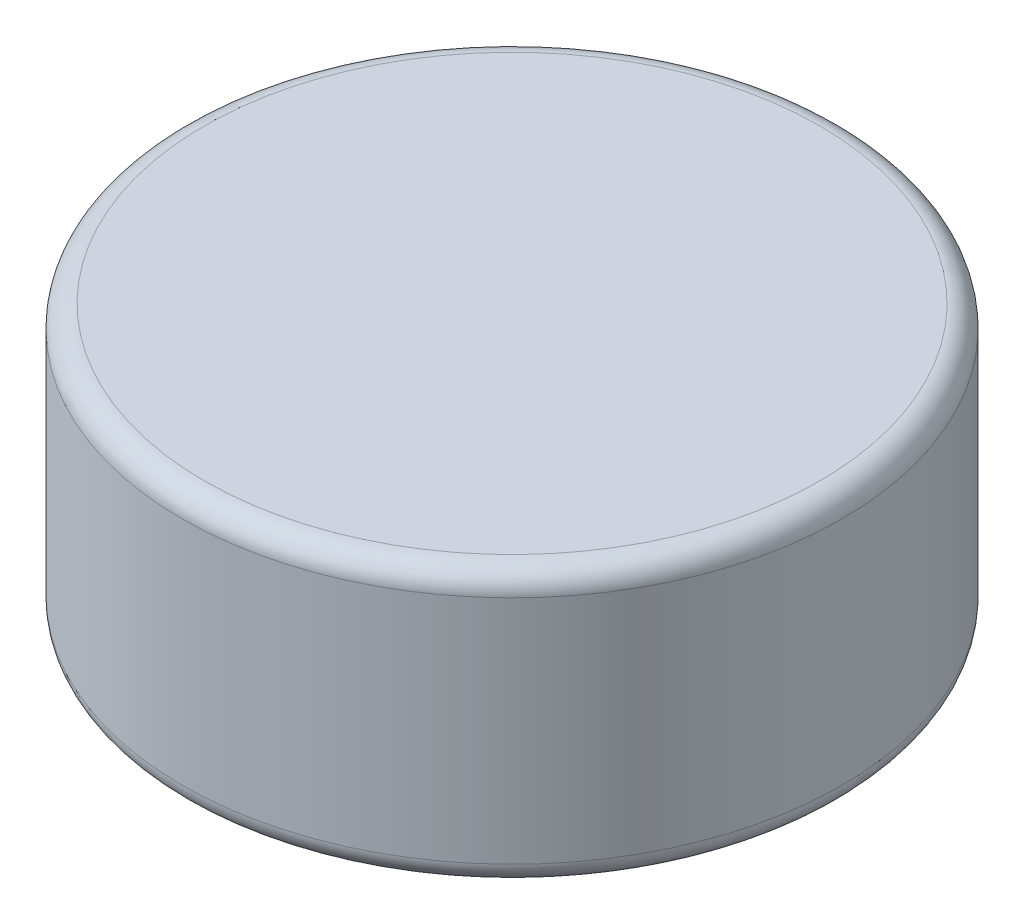
from build123d import *

# Parameters (mm, degrees)
SKETCH1_R           = 3
BOSS_EXTRUDE1_DEPTH = 1.25
FILLET1_R           = 0.2


with BuildPart() as part:
    # Sketch1 → Boss-Extrude1 (new, symmetric)
    with BuildSketch(Plane(origin=(0, 0, 0), x_dir=(1, 0, 0), z_dir=(0, 1, 0))):
        Circle(SKETCH1_R)
    extrude(amount=BOSS_EXTRUDE1_DEPTH, both=True)

    # Fillet1
    fillet1_edges = [part.edges().sort_by_distance(p)[0] for p in [
        (-3, -1.25, 0),
        (-3, 1.25, 0),
    ]]
    fillet(fillet1_edges, radius=FILLET1_R)


solid = part.part
